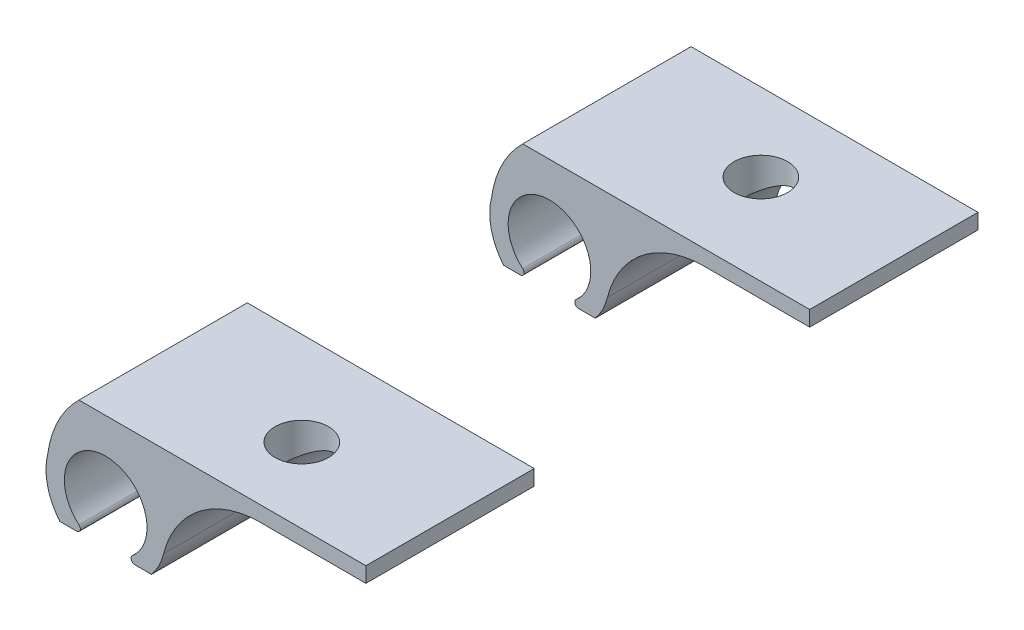
from build123d import *

# Parameters (mm, degrees)
EXTRUDE_1_DEPTH                            = 3.9
EXTRUDE_3_DEPTH                            = 20
EXTRUDE_5_DEPTH                            = 20
FILLET_1_R                                 = 0.25
FILLET_1_OF_MIRROR_2_R                     = 0.25
SKETCH_7_R                                 = 5.5
CUT_EXTRUDE_3_DEPTH                        = 69.146236458
MIRROR_3_AT_THE_SECOND_PLANE_COPY_1_SKET_R = 5.5
MIRROR_3_AT_THE_SECOND_PLANE_COPY_1_DEPTH  = 69.146236458
ESQUISSE1_W                                = 44.6
ESQUISSE1_H                                = 40
ENL_V_MAT_EXTRU_1_DEPTH                    = 1.54
ENL_V_MAT_EXTRU_2_DEPTH                    = 57.761068742
ESQUISSE3_W                                = 50
ESQUISSE3_H                                = 1.36
ENL_V_MAT_EXTRU_3_DEPTH                    = 64.372466761
ESQUISSE4_W                                = 27.815449133
ESQUISSE4_H                                = 40
ENL_V_MAT_EXTRU_4_DEPTH                    = 54.066651895
ESQUISSE5_R                                = 1.75
ENL_V_MAT_EXTRU_5_DEPTH                    = 54.198396436
ESQUISSE6_W                                = 25
ESQUISSE6_H                                = 18
ENL_V_MAT_EXTRU_6_DEPTH                    = 54.198396473


with BuildPart() as part:
    # Эскиз1 → Бобышка-Вытянуть1 (new body)
    with BuildSketch(Plane(origin=(0, 0, 0), x_dir=(1, 0, 0), z_dir=(0, 1, 0))):
        with BuildLine():
            ThreePointArc((-44.6, -23.2), (-43.428427125, -26.028427125), (-40.6, -27.2))
            Line((-40.6, -27.2), (40.6, -27.2))
            ThreePointArc((40.6, -27.2), (43.428427125, -26.028427125), (44.6, -23.2))
            Line((44.6, -23.2), (44.6, 23.2))
            ThreePointArc((44.6, 23.2), (43.428427125, 26.028427125), (40.6, 27.2))
            Line((40.6, 27.2), (33.6, 27.2))
            Line((33.6, 27.2), (-5.4, 27.2))
            Line((-5.4, 27.2), (-40.6, 27.2))
            ThreePointArc((-40.6, 27.2), (-43.428427125, 26.028427125), (-44.6, 23.2))
            Line((-44.6, 23.2), (-44.6, -23.2))
        make_face()
    extrude(amount=EXTRUDE_1_DEPTH)



with BuildPart() as body_2:
    # Эскиз3 → Бобышка-Вытянуть3 (new, symmetric)
    with BuildSketch(Plane.XY):
        with BuildLine():
            Line((-47.815262386, -6.499919999), (-45.841869662, -6.499919999))
            ThreePointArc((-45.841869662, -6.499919999), (-44.821869662, -1.3), (-43.801869662, -6.499919999))
            Line((-43.801869662, -6.499919999), (-41.828476938, -6.499919999))
            ThreePointArc((-41.828476938, -6.499919999), (-44.821869662, -0.1), (-47.815262386, -6.499919999))
        make_face()
    extrude_3 = extrude(amount=EXTRUDE_3_DEPTH, both=True)


with BuildPart() as part_1:
    add(part.part)

    add(body_2.part)  # Бобышка-Вытянуть5 merges body 2
    # Эскиз5 → Бобышка-Вытянуть5 (add, symmetric)
    with BuildSketch(Plane.XY):
        with BuildLine():
            ThreePointArc((-41.631827579, 2.999901942), (-46.932438451, 0.61464415), (-48.60377877, -4.952451312))
            Line((-48.60377877, -4.952451312), (-47.348297278, -4.952451312))
            ThreePointArc((-47.348297278, -4.952451312), (-44.821869662, -1.3), (-42.295442046, -4.952451312))
            Line((-42.295442046, -4.952451312), (-41.039960555, -4.952451312))
            ThreePointArc((-41.039960555, -4.952451312), (-38.684888017, -1.351535806), (-34.6, 0))
            Line((-34.6, 0), (-36.641600827, 0.870983001))
            ThreePointArc((-36.641600827, 0.870983001), (-38.922074934, 2.438561027), (-41.631827579, 2.999901942))
        make_face()
    extrude_5 = extrude(amount=EXTRUDE_5_DEPTH, both=True)

    # Скругление1
    fillet_1_edges = [part_1.edges().sort_by_distance(p)[0] for p in [
        (-43.801869662, -6.499919999, 0),
        (-45.841869662, -6.499919999, 0),
    ]]
    fillet(fillet_1_edges, radius=FILLET_1_R)

    # Зеркальное отражение1: Бобышка-Вытянуть5 across plane
    add(extrude_5.mirror(Plane(origin=(0, 0, 0), x_dir=(0, 0, 1), z_dir=(1, 0, 0))))

    # Зеркальное отражение2: Бобышка-Вытянуть3 across plane
    add(extrude_3.mirror(Plane(origin=(0, 0, 0), x_dir=(0, 0, 1), z_dir=(1, 0, 0))))

    # Скругление1 of Зеркальное отражение2
    fillet_1_of_mirror_2_edges = [part_1.edges().sort_by_distance(p)[0] for p in [
        (43.801869662, -6.499919999, 0),
        (45.841869662, -6.499919999, 0),
    ]]
    fillet(fillet_1_of_mirror_2_edges, radius=FILLET_1_OF_MIRROR_2_R)

    # Эскиз7 → Вырез-Вытянуть3 (cut, through all)
    with BuildSketch(Plane.XY.offset(20)):
        with Locations((-45, -4)):
            Circle(SKETCH_7_R)
    cut_extrude_3 = extrude(amount=CUT_EXTRUDE_3_DEPTH, mode=Mode.SUBTRACT)

    # Зеркальное отражение3: Вырез-Вытянуть3 across plane
    add(cut_extrude_3.mirror(Plane(origin=(0, 0, 0), x_dir=(0, 0, 1), z_dir=(1, 0, 0))), mode=Mode.SUBTRACT)

    # Зеркальное отражение3 at the second plane: Вырез-Вытянуть3 across plane
    add(cut_extrude_3.mirror(Plane.XY), mode=Mode.SUBTRACT)

    # Зеркальное отражение3 at the second plane copy 1 sket → Зеркальное отражение3 at the second plane copy 1 (cut, through all)
    with BuildSketch(Plane(origin=(0, 0, -20), x_dir=(-1, 0, 0), z_dir=(0, 0, -1))):
        with Locations((-45, -4)):
            Circle(MIRROR_3_AT_THE_SECOND_PLANE_COPY_1_SKET_R)
    extrude(amount=MIRROR_3_AT_THE_SECOND_PLANE_COPY_1_DEPTH, mode=Mode.SUBTRACT)

    # Esquisse1 → Enlèv. mat.-Extru.1 (cut)
    with BuildSketch(Plane(origin=(0, 3.9, 0), x_dir=(1, 0, 0), z_dir=(0, 1, 0))):
        with Locations((-22.3, 0)):
            Rectangle(ESQUISSE1_W, ESQUISSE1_H)
    extrude(amount=-ENL_V_MAT_EXTRU_1_DEPTH, mode=Mode.SUBTRACT)

    # Esquisse2 → Enlèv. mat.-Extru.2 (cut, through all)
    with BuildSketch(Plane(origin=(0, 3.9, 0), x_dir=(1, 0, 0), z_dir=(0, 1, 0))):
        Polygon((-44.6, 20), (-44.6, 27.2), (51.6, 27.2), (51.6, -27.2), (-44.6, -27.2), (-44.6, -20), (0, -20), (0, 20), align=None)
    extrude(amount=-ENL_V_MAT_EXTRU_2_DEPTH, mode=Mode.SUBTRACT)

    # Esquisse3 → Enlèv. mat.-Extru.3 (cut, through all)
    with BuildSketch(Plane.XY.offset(20)):
        with Locations((-25, 1.68)):
            Rectangle(ESQUISSE3_W, ESQUISSE3_H)
    extrude(amount=-ENL_V_MAT_EXTRU_3_DEPTH, mode=Mode.SUBTRACT)

    # Esquisse4 → Enlèv. mat.-Extru.4 (cut, through all)
    with BuildSketch(Plane.XZ):
        with Locations((-13.907724567, 0)):
            Rectangle(ESQUISSE4_W, ESQUISSE4_H)
    extrude(amount=-ENL_V_MAT_EXTRU_4_DEPTH, mode=Mode.SUBTRACT)

    # Esquisse5 → Enlèv. mat.-Extru.5 (cut, through all)
    with BuildSketch(Plane(origin=(0, 1, 0), x_dir=(1, 0, 0), z_dir=(0, 1, 0))):
        with Locations((-36.905449133, 14.9)):
            Circle(ESQUISSE5_R)
        with Locations((-36.905449133, -15.1)):
            Circle(ESQUISSE5_R)
    extrude(amount=-ENL_V_MAT_EXTRU_5_DEPTH, mode=Mode.SUBTRACT)

    # Esquisse6 → Enlèv. mat.-Extru.6 (cut, through all)
    with BuildSketch(Plane(origin=(0, 1, 0), x_dir=(1, 0, 0), z_dir=(0, 1, 0))):
        with Locations((-40.315449133, 0)):
            Rectangle(ESQUISSE6_W, ESQUISSE6_H)
    extrude(amount=-ENL_V_MAT_EXTRU_6_DEPTH, mode=Mode.SUBTRACT)


with BuildPart() as enl_v_mat_extru_6_piece_1:
    # of the separate pieces the step leaves, piece 1, a body of its own (enl_v_mat_extru_6_pieces)
    add(part_1.part.solids().sort_by_distance((-42.913896916, -6.499919999, -20))[0])


with BuildPart() as enl_v_mat_extru_6_piece_2:
    # of the separate pieces the step leaves, piece 2, a body of its own (enl_v_mat_extru_6_pieces)
    add(part_1.part.solids().sort_by_distance((-42.913896916, -6.499919999, 20))[0])


solid = Compound([enl_v_mat_extru_6_piece_1.part, enl_v_mat_extru_6_piece_2.part])
